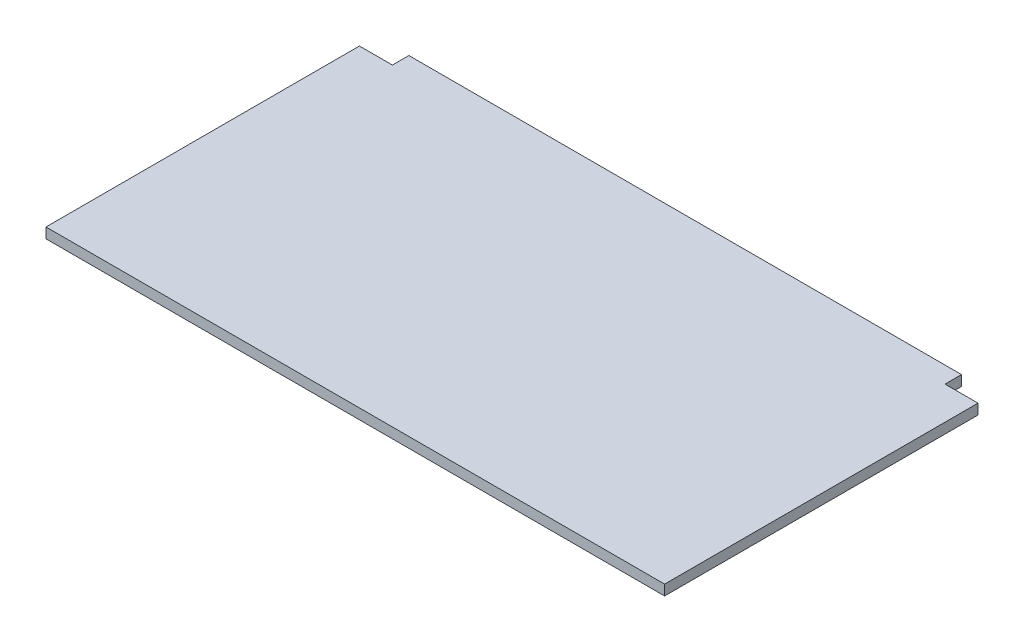
from build123d import *

# Parameters (mm, degrees)
SKETCH1_W           = 1500
SKETCH1_H           = 800
BOSS_EXTRUDE1_DEPTH = 25
SKETCH2_W           = 80
SKETCH2_H           = 40
CUT_EXTRUDE1_DEPTH  = 851.367567585


with BuildPart() as part:
    # Sketch1 → Boss-Extrude1 (new body)
    with BuildSketch(Plane(origin=(0, 0, 0), x_dir=(1, 0, 0), z_dir=(0, 1, 0))):
        Rectangle(SKETCH1_W, SKETCH1_H)
    extrude(amount=BOSS_EXTRUDE1_DEPTH)

    # Sketch2 → Cut-Extrude1 (cut, through all)
    with BuildSketch(Plane(origin=(0, 25, 0), x_dir=(1, 0, 0), z_dir=(0, 1, 0))):
        with Locations((710, 380)):
            Rectangle(SKETCH2_W, SKETCH2_H)
        with Locations((-710, 380)):
            Rectangle(SKETCH2_W, SKETCH2_H)
    extrude(amount=-CUT_EXTRUDE1_DEPTH, mode=Mode.SUBTRACT)


solid = part.part
